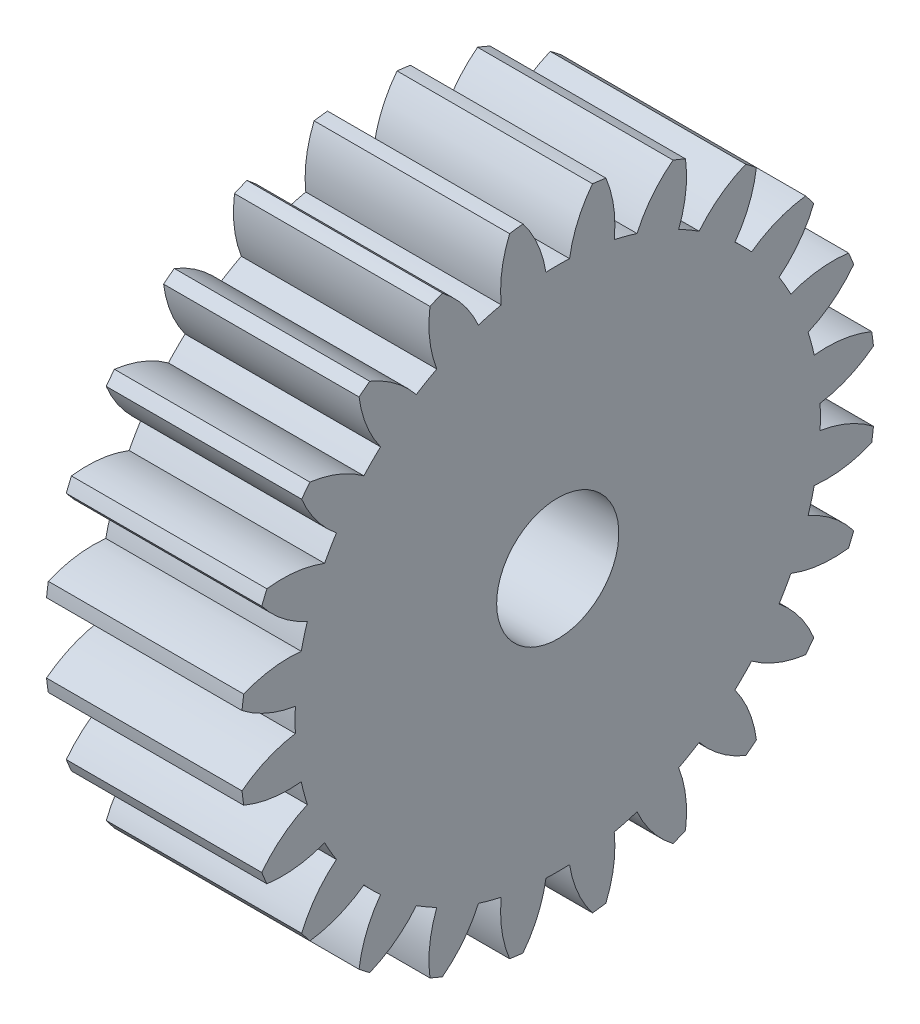
from build123d import *

# Parameters (mm, degrees)
BASPROSKE_W     = 8
BASPROSKE_H     = 13
TOOTHCUT_DEPTH  = 21.049937656
TEETHCUTS_COUNT = 24
TEETHCUTS_ANGLE = 345
BORSKE_R        = 2.5
BORE_DEPTH      = 50.0000508


with BuildPart() as part:
    # BasProSke → Base-Revolve (revolve)
    with BuildSketch(Plane(origin=(0, 0, 0), x_dir=(1, 0, 0), z_dir=(0, 1, 0))):
        with Locations((4, 6.5)):
            Rectangle(BASPROSKE_W, BASPROSKE_H)
    revolve(axis=Axis((-10, 0, 0), (1, 0, 0)))

    # TooCutSke → ToothCut (cut, through all)
    with BuildSketch(Plane(origin=(0, 0, 0), x_dir=(0, 0, -1), z_dir=(1, 0, 0))):
        with BuildLine():
            ThreePointArc((0.483448384, 10.738122679), (0, 10.749), (-0.483448384, 10.738122679))
            ThreePointArc((-0.483448384, 10.738122679), (-0.821636462, 11.902754369), (-1.44092227, 12.945454344))
            ThreePointArc((-1.44092227, 12.945454344), (0, 13.0254), (1.44092227, 12.945454344))
            ThreePointArc((1.44092227, 12.945454344), (0.821636462, 11.902754369), (0.483448384, 10.738122679))
        make_face()
    toothcut = extrude(amount=TOOTHCUT_DEPTH, mode=Mode.SUBTRACT)

    # TeethCuts: ToothCut ×24 about axis
    teethcuts_axis = Axis((-10, 0, 0), (1, 0, 0))
    for i in range(1, TEETHCUTS_COUNT):
        add(toothcut.rotate(teethcuts_axis, i * TEETHCUTS_ANGLE / (TEETHCUTS_COUNT - 1)), mode=Mode.SUBTRACT)

    # BorSke → Bore (cut, symmetric)
    with BuildSketch(Plane(origin=(0, 0, 0), x_dir=(0, 0, -1), z_dir=(1, 0, 0))):
        Circle(BORSKE_R)
    extrude(amount=BORE_DEPTH, both=True, mode=Mode.SUBTRACT)


solid = part.part
